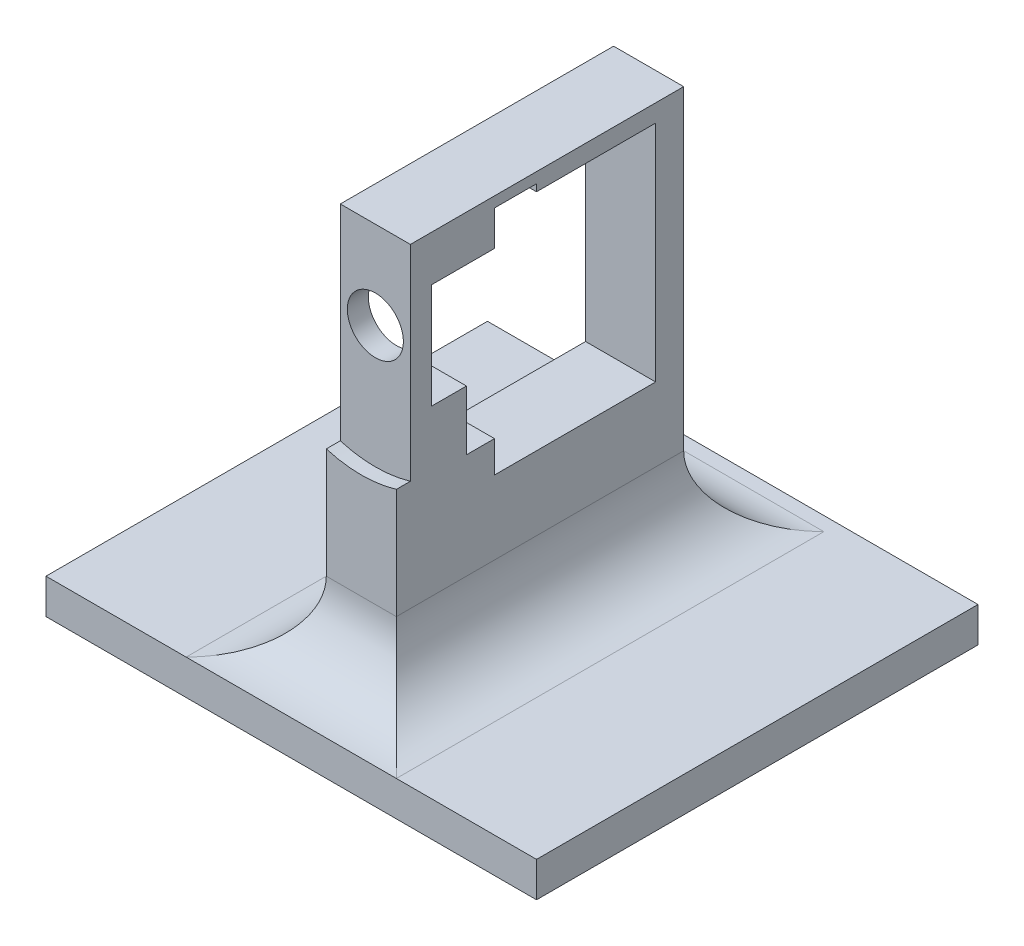
from build123d import *

# Parameters (mm, degrees)
BOSS_EXTRUDE1_DEPTH      = 20
BOSS_EXTRUDE1_DEPTH_BACK = 43
SKETCH1_W                = 70
SKETCH1_H                = 5
BOSS_EXTRUDE2_DEPTH      = 10
BOSS_EXTRUDE2_DEPTH_BACK = 10
SKETCH2_W                = 10
SKETCH2_H                = 55
CUT_EXTRUDE2_DEPTH       = 10
CUT_EXTRUDE2_DEPTH_BACK  = 2
SKETCH4_R                = 1.25
SKETCH5_R                = 1.25
CUT_EXTRUDE3_DEPTH       = 20
CUT_EXTRUDE4_REACH       = 84.19
SKETCH6_W                = 3
SKETCH6_H                = 6
SKETCH6_H_2              = 17.5
SKETCH6_W_2              = 4
SKETCH6_H_3              = 5
SKETCH6_H_4              = 4.5
SKETCH6_W_3              = 5
SKETCH6_H_5              = 9
SKETCH6_W_4              = 13
SKETCH7_R                = 4
CUT_EXTRUDE5_DEPTH       = 6
SKETCH8_W                = 4
SKETCH8_H                = 15
SKETCH8_W_2              = 17
SKETCH8_H_2              = 20.5
BOSS_EXTRUDE3_DEPTH      = 10
SKETCH9_R                = 2
BOSS_EXTRUDE4_DEPTH      = 8
FILLET2_R                = 2
FILLET1_R                = 10


with BuildPart() as part:
    # Sketch1 → Boss-Extrude1 (new, two sides: drawn at the far end of the back side and taken through both)
    with BuildSketch(Plane.XY.offset(-BOSS_EXTRUDE1_DEPTH_BACK)):
        Rectangle(SKETCH1_W, SKETCH1_H)
    extrude(amount=BOSS_EXTRUDE1_DEPTH + BOSS_EXTRUDE1_DEPTH_BACK)

    # Sketch2 → Boss-Extrude2 (add, two sides: drawn at the far end of the back side and taken through both)
    with BuildSketch(Plane.XY.offset(-BOSS_EXTRUDE2_DEPTH_BACK)):
        with Locations((0, 30)):
            Rectangle(SKETCH2_W, SKETCH2_H)
    extrude(amount=BOSS_EXTRUDE2_DEPTH + BOSS_EXTRUDE2_DEPTH_BACK)

    # Sketch4 → Cut-Extrude2 (cut, two sides: drawn at the far end of the back side and taken through both)
    # profile 1 of 2: a face of its own
    with BuildSketch(Plane.XY.offset(10).offset(-CUT_EXTRUDE2_DEPTH_BACK)):
        with BuildLine():
            ThreePointArc((5, 28.229490169), (14.0312152, 34.541749668), (17.5, 45))
            ThreePointArc((17.5, 45), (-10.458250332, 59.0312152), (-5, 28.229490169))
            Line((-5, 28.229490169), (-5, 57.5))
            Line((-5, 57.5), (5, 57.5))
            Line((5, 57.5), (5, 28.229490169))
        make_face()
    # profile 2 of 2: a face of its own
    with BuildSketch(Plane.XY.offset(10).offset(-CUT_EXTRUDE2_DEPTH_BACK)):
        with BuildLine():
            Line((-5, 57.5), (-5, 28.229490169))
            ThreePointArc((-5, 28.229490169), (0, 27.5), (5, 28.229490169))
            Line((5, 28.229490169), (5, 57.5))
            Line((5, 57.5), (-5, 57.5))
        make_face()
        with Locations((0, 45)):
            Circle(SKETCH4_R, mode=Mode.SUBTRACT)
    extrude(amount=CUT_EXTRUDE2_DEPTH + CUT_EXTRUDE2_DEPTH_BACK, mode=Mode.SUBTRACT)

    # Sketch5 → Cut-Extrude3 (cut)
    with BuildSketch(Plane.XY.offset(10)):
        with Locations((0, 45)):
            Circle(SKETCH5_R)
    extrude(amount=-CUT_EXTRUDE3_DEPTH, mode=Mode.SUBTRACT)

    # Cut-Extrude4: up to this face of the body (flat: up to its plane)
    cut_extrude4_end = Plane(part.part.faces().sort_by_distance((5, 29.276865139, -0.505895275))[0])
    # Sketch6 → Cut-Extrude4 (cut, up to the picked face)
    with BuildSketch(Plane.ZY.offset(5), mode=Mode.PRIVATE) as cut_extrude4_sk1:
        with Locations((-5.5, 48)):
            Rectangle(SKETCH6_W, SKETCH6_H)
    cut_extrude4_tool1 = split(extrude(cut_extrude4_sk1.sketch, amount=-CUT_EXTRUDE4_REACH, mode=Mode.PRIVATE), bisect_by=cut_extrude4_end, keep=Keep.BOTH, mode=Mode.PRIVATE)
    # Sketch6 → Cut-Extrude4 (cut, up to the picked face)
    with BuildSketch(Plane.ZY.offset(5), mode=Mode.PRIVATE) as cut_extrude4_sk2:
        Polygon((-7, 27.5), (-7, 45), (-7, 51), (-23, 51), (-23, 27.5), (-10, 27.5), align=None)
    cut_extrude4_tool2 = split(extrude(cut_extrude4_sk2.sketch, amount=-CUT_EXTRUDE4_REACH, mode=Mode.PRIVATE), bisect_by=cut_extrude4_end, keep=Keep.BOTH, mode=Mode.PRIVATE)
    # Sketch6 → Cut-Extrude4 (cut, up to the picked face)
    with BuildSketch(Plane.ZY.offset(5), mode=Mode.PRIVATE) as cut_extrude4_sk3:
        with Locations((-5.5, 36.25)):
            Rectangle(SKETCH6_W, SKETCH6_H_2)
    cut_extrude4_tool3 = split(extrude(cut_extrude4_sk3.sketch, amount=-CUT_EXTRUDE4_REACH, mode=Mode.PRIVATE), bisect_by=cut_extrude4_end, keep=Keep.BOTH, mode=Mode.PRIVATE)
    # Sketch6 → Cut-Extrude4 (cut, up to the picked face)
    with BuildSketch(Plane.ZY.offset(5), mode=Mode.PRIVATE) as cut_extrude4_sk4:
        with Locations((-2, 48)):
            Rectangle(SKETCH6_W_2, SKETCH6_H)
    cut_extrude4_tool4 = split(extrude(cut_extrude4_sk4.sketch, amount=-CUT_EXTRUDE4_REACH, mode=Mode.PRIVATE), bisect_by=cut_extrude4_end, keep=Keep.BOTH, mode=Mode.PRIVATE)
    # Sketch6 → Cut-Extrude4 (cut, up to the picked face)
    with BuildSketch(Plane.ZY.offset(5), mode=Mode.PRIVATE) as cut_extrude4_sk5:
        Polygon((0, 45), (-4, 45), (-4, 27.5), (0, 27.5), (0, 36), align=None)
    cut_extrude4_tool5 = split(extrude(cut_extrude4_sk5.sketch, amount=-CUT_EXTRUDE4_REACH, mode=Mode.PRIVATE), bisect_by=cut_extrude4_end, keep=Keep.BOTH, mode=Mode.PRIVATE)
    # Sketch6 → Cut-Extrude4 (cut, up to the picked face)
    with BuildSketch(Plane.ZY.offset(5), mode=Mode.PRIVATE) as cut_extrude4_sk6:
        with Locations((-5.5, 53.5)):
            Rectangle(SKETCH6_W, SKETCH6_H_3)
    cut_extrude4_tool6 = split(extrude(cut_extrude4_sk6.sketch, amount=-CUT_EXTRUDE4_REACH, mode=Mode.PRIVATE), bisect_by=cut_extrude4_end, keep=Keep.BOTH, mode=Mode.PRIVATE)
    # Sketch6 → Cut-Extrude4 (cut, up to the picked face)
    with BuildSketch(Plane.ZY.offset(5), mode=Mode.PRIVATE) as cut_extrude4_sk7:
        Polygon((-23, 51), (-7, 51), (-7, 56), (-10, 56), (-23, 56), align=None)
    cut_extrude4_tool7 = split(extrude(cut_extrude4_sk7.sketch, amount=-CUT_EXTRUDE4_REACH, mode=Mode.PRIVATE), bisect_by=cut_extrude4_end, keep=Keep.BOTH, mode=Mode.PRIVATE)
    # Sketch6 → Cut-Extrude4 (cut, up to the picked face)
    with BuildSketch(Plane.ZY.offset(5), mode=Mode.PRIVATE) as cut_extrude4_sk8:
        with Locations((-8.5, 25.25)):
            Rectangle(SKETCH6_W, SKETCH6_H_4)
    cut_extrude4_tool8 = split(extrude(cut_extrude4_sk8.sketch, amount=-CUT_EXTRUDE4_REACH, mode=Mode.PRIVATE), bisect_by=cut_extrude4_end, keep=Keep.BOTH, mode=Mode.PRIVATE)
    # Sketch6 → Cut-Extrude4 (cut, up to the picked face)
    with BuildSketch(Plane.ZY.offset(5), mode=Mode.PRIVATE) as cut_extrude4_sk9:
        with Locations((-5.5, 25.25)):
            Rectangle(SKETCH6_W, SKETCH6_H_4)
    cut_extrude4_tool9 = split(extrude(cut_extrude4_sk9.sketch, amount=-CUT_EXTRUDE4_REACH, mode=Mode.PRIVATE), bisect_by=cut_extrude4_end, keep=Keep.BOTH, mode=Mode.PRIVATE)
    # Sketch6 → Cut-Extrude4 (cut, up to the picked face)
    with BuildSketch(Plane.ZY.offset(5), mode=Mode.PRIVATE) as cut_extrude4_sk10:
        with Locations((2.5, 48)):
            Rectangle(SKETCH6_W_3, SKETCH6_H)
    cut_extrude4_tool10 = split(extrude(cut_extrude4_sk10.sketch, amount=-CUT_EXTRUDE4_REACH, mode=Mode.PRIVATE), bisect_by=cut_extrude4_end, keep=Keep.BOTH, mode=Mode.PRIVATE)
    # Sketch6 → Cut-Extrude4 (cut, up to the picked face)
    with BuildSketch(Plane.ZY.offset(5), mode=Mode.PRIVATE) as cut_extrude4_sk11:
        with Locations((2.5, 40.5)):
            Rectangle(SKETCH6_W_3, SKETCH6_H_5)
    cut_extrude4_tool11 = split(extrude(cut_extrude4_sk11.sketch, amount=-CUT_EXTRUDE4_REACH, mode=Mode.PRIVATE), bisect_by=cut_extrude4_end, keep=Keep.BOTH, mode=Mode.PRIVATE)
    # Sketch6 → Cut-Extrude4 (cut, up to the picked face)
    with BuildSketch(Plane.ZY.offset(5), mode=Mode.PRIVATE) as cut_extrude4_sk12:
        with Locations((-16.5, 25.25)):
            Rectangle(SKETCH6_W_4, SKETCH6_H_4)
    cut_extrude4_tool12 = split(extrude(cut_extrude4_sk12.sketch, amount=-CUT_EXTRUDE4_REACH, mode=Mode.PRIVATE), bisect_by=cut_extrude4_end, keep=Keep.BOTH, mode=Mode.PRIVATE)
    add(cut_extrude4_tool1.solids().sort_by(Axis((-5, 48, -5.5), (1, 0, 0)))[0], mode=Mode.SUBTRACT)
    add(cut_extrude4_tool2.solids().sort_by(Axis((-5, 39.25, -15), (1, 0, 0)))[0], mode=Mode.SUBTRACT)
    add(cut_extrude4_tool3.solids().sort_by(Axis((-5, 36.25, -5.5), (1, 0, 0)))[0], mode=Mode.SUBTRACT)
    add(cut_extrude4_tool4.solids().sort_by(Axis((-5, 48, -2), (1, 0, 0)))[0], mode=Mode.SUBTRACT)
    add(cut_extrude4_tool5.solids().sort_by(Axis((-5, 36.25, -2), (1, 0, 0)))[0], mode=Mode.SUBTRACT)
    add(cut_extrude4_tool6.solids().sort_by(Axis((-5, 53.5, -5.5), (1, 0, 0)))[0], mode=Mode.SUBTRACT)
    add(cut_extrude4_tool7.solids().sort_by(Axis((-5, 53.5, -15), (1, 0, 0)))[0], mode=Mode.SUBTRACT)
    add(cut_extrude4_tool8.solids().sort_by(Axis((-5, 25.25, -8.5), (1, 0, 0)))[0], mode=Mode.SUBTRACT)
    add(cut_extrude4_tool9.solids().sort_by(Axis((-5, 25.25, -5.5), (1, 0, 0)))[0], mode=Mode.SUBTRACT)
    add(cut_extrude4_tool10.solids().sort_by(Axis((-5, 48, 2.5), (1, 0, 0)))[0], mode=Mode.SUBTRACT)
    add(cut_extrude4_tool11.solids().sort_by(Axis((-5, 40.5, 2.5), (1, 0, 0)))[0], mode=Mode.SUBTRACT)
    add(cut_extrude4_tool12.solids().sort_by(Axis((-5, 25.25, -16.5), (1, 0, 0)))[0], mode=Mode.SUBTRACT)

    # Sketch7 → Cut-Extrude5 (cut)
    with BuildSketch(Plane(origin=(0, 0, 5), x_dir=(-1, 0, 0), z_dir=(0, 0, -1))):
        with Locations(Location((0, 45, 0), (0, 0, 90))):
            Circle(SKETCH7_R)
    extrude(amount=-CUT_EXTRUDE5_DEPTH, mode=Mode.SUBTRACT)

    # Sketch8 → Boss-Extrude3 (add)
    with BuildSketch(Plane.ZY.offset(5)):
        Polygon((-10, 55), (-10, 57.5), (-31, 57.5), (-31, 55), (-27, 55), align=None)
        with Locations((-29, 47.5)):
            Rectangle(SKETCH8_W, SKETCH8_H)
        Polygon((-27, 40), (-31, 40), (-31, 2.5), (-27, 2.5), (-27, 23), align=None)
        with Locations((-18.5, 12.75)):
            Rectangle(SKETCH8_W_2, SKETCH8_H_2)
    extrude(amount=-BOSS_EXTRUDE3_DEPTH)

    # Sketch9 → Boss-Extrude4 (add)
    with BuildSketch(Plane.XY.offset(-27)):
        with Locations((0, 45)):
            Circle(SKETCH9_R)
    extrude(amount=-BOSS_EXTRUDE4_DEPTH)

    # Fillet2
    fillet2_edges = [part.edges().sort_by_distance(p)[0] for p in [
        (-2, 45, -35),
    ]]
    fillet(fillet2_edges, radius=FILLET2_R)

    # Fillet1
    fillet1_edges = [part.edges().sort_by_distance(p)[0] for p in [
        (0, 2.5, -31),
        (5, 2.5, -10.5),
        (-5, 2.5, -10.5),
        (0, 2.5, 10),
    ]]
    fillet(fillet1_edges, radius=FILLET1_R - 0.0001)  # a hair under: the kernel refuses the full size


solid = part.part
